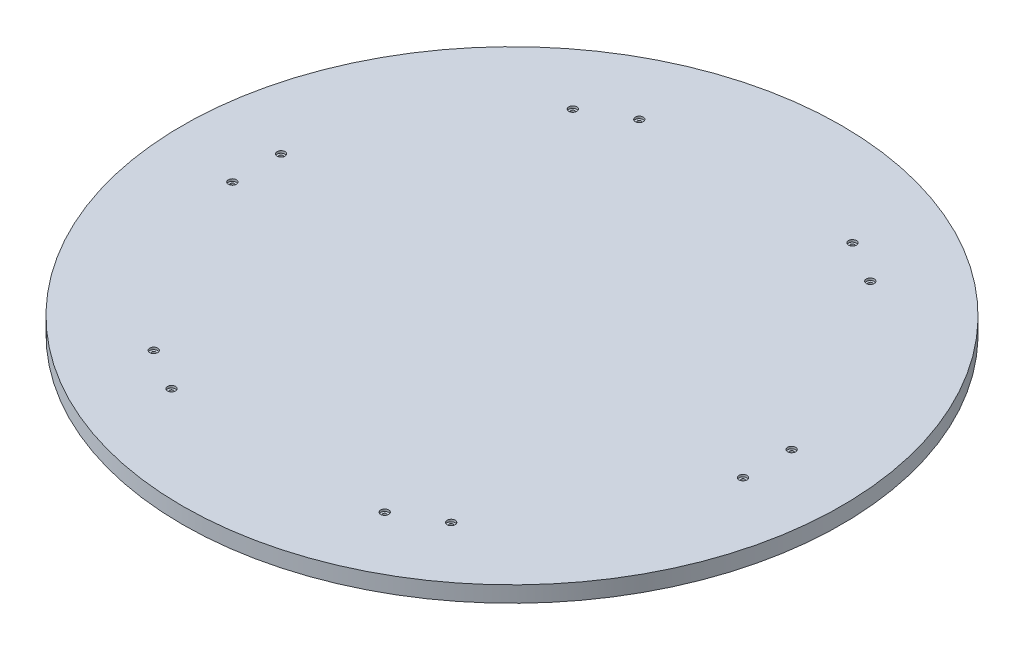
from build123d import *

# Parameters (mm, degrees)
SKETCH1_R           = 261.9375
BOSS_EXTRUDE1_DEPTH = 12.7
CUT_EXTRUDE4_DEPTH  = 6.35
SKETCH7_R           = 1.524
CUT_EXTRUDE5_DEPTH  = 371.489986791
SKETCH8_R           = 3.175
CUT_EXTRUDE6_DEPTH  = 1.778


with BuildPart() as part:
    # Sketch1 → Boss-Extrude1 (new body)
    with BuildSketch(Plane(origin=(0, 0, 0), x_dir=(1, 0, 0), z_dir=(0, 1, 0))):
        Circle(SKETCH1_R)
    extrude(amount=BOSS_EXTRUDE1_DEPTH)

    # Sketch6 → Cut-Extrude4 (cut)
    with BuildSketch(Plane.XZ):
        with BuildLine():
            Line((215.9, 19.05), (215.9, -19.05))
            ThreePointArc((215.9, -19.05), (203.2, -31.75), (190.5, -19.05))
            Line((190.5, -19.05), (190.5, 19.05))
            ThreePointArc((190.5, 19.05), (203.2, 31.75), (215.9, 19.05))
        make_face()
        with BuildLine():
            Line((124.447783942, -177.449884677), (91.452216058, -196.499884677))
            ThreePointArc((91.452216058, -196.499884677), (74.10369343, -191.851362049), (78.752216058, -174.502839421))
            Line((78.752216058, -174.502839421), (111.747783942, -155.452839421))
            ThreePointArc((111.747783942, -155.452839421), (129.09630657, -160.101362049), (124.447783942, -177.449884677))
        make_face()
        with BuildLine():
            Line((-91.452216058, -196.499884677), (-124.447783942, -177.449884677))
            ThreePointArc((-124.447783942, -177.449884677), (-129.09630657, -160.101362049), (-111.747783942, -155.452839421))
            Line((-111.747783942, -155.452839421), (-78.752216058, -174.502839421))
            ThreePointArc((-78.752216058, -174.502839421), (-74.10369343, -191.851362049), (-91.452216058, -196.499884677))
        make_face()
        with BuildLine():
            Line((-215.9, -19.05), (-215.9, 19.05))
            ThreePointArc((-215.9, 19.05), (-203.2, 31.75), (-190.5, 19.05))
            Line((-190.5, 19.05), (-190.5, -19.05))
            ThreePointArc((-190.5, -19.05), (-203.2, -31.75), (-215.9, -19.05))
        make_face()
        with BuildLine():
            Line((-124.447783942, 177.449884677), (-91.452216058, 196.499884677))
            ThreePointArc((-91.452216058, 196.499884677), (-74.10369343, 191.851362049), (-78.752216058, 174.502839421))
            Line((-78.752216058, 174.502839421), (-111.747783942, 155.452839421))
            ThreePointArc((-111.747783942, 155.452839421), (-129.09630657, 160.101362049), (-124.447783942, 177.449884677))
        make_face()
        with BuildLine():
            Line((91.452216058, 196.499884677), (124.447783942, 177.449884677))
            ThreePointArc((124.447783942, 177.449884677), (129.09630657, 160.101362049), (111.747783942, 155.452839421))
            Line((111.747783942, 155.452839421), (78.752216058, 174.502839421))
            ThreePointArc((78.752216058, 174.502839421), (74.10369343, 191.851362049), (91.452216058, 196.499884677))
        make_face()
    extrude(amount=-CUT_EXTRUDE4_DEPTH, mode=Mode.SUBTRACT)

    # Sketch7 → Cut-Extrude5 (cut, through all)
    with BuildSketch(Plane.XZ.offset(-6.35)):
        with Locations((203.2, -19.05)):
            Circle(SKETCH7_R)
        with Locations((203.2, 19.624496846)):
            Circle(SKETCH7_R)
        with Locations((85.102216058, -185.501362049)):
            Circle(SKETCH7_R)
        with Locations((118.595312805, -166.164113626)):
            Circle(SKETCH7_R)
        with Locations((-118.097783942, -166.451362049)):
            Circle(SKETCH7_R)
        with Locations((-84.604687195, -185.788610472)):
            Circle(SKETCH7_R)
        with Locations((-203.2, 19.05)):
            Circle(SKETCH7_R)
        with Locations((-203.2, -19.624496846)):
            Circle(SKETCH7_R)
        with Locations((-85.102216058, 185.501362049)):
            Circle(SKETCH7_R)
        with Locations((-118.595312805, 166.164113626)):
            Circle(SKETCH7_R)
        with Locations((118.097783942, 166.451362049)):
            Circle(SKETCH7_R)
        with Locations((84.604687195, 185.788610472)):
            Circle(SKETCH7_R)
    extrude(amount=-CUT_EXTRUDE5_DEPTH, mode=Mode.SUBTRACT)

    # Sketch8 → Cut-Extrude6 (cut)
    with BuildSketch(Plane(origin=(0, 12.7, 0), x_dir=(1, 0, 0), z_dir=(0, 1, 0))):
        with Locations((203.2, -19.624496846)):
            Circle(SKETCH8_R)
        with Locations((203.2, 19.05)):
            Circle(SKETCH8_R)
        with Locations((118.097783942, -166.451362049)):
            Circle(SKETCH8_R)
        with Locations((84.604687195, -185.788610472)):
            Circle(SKETCH8_R)
        with Locations((-85.102216058, -185.501362049)):
            Circle(SKETCH8_R)
        with Locations((-118.595312805, -166.164113626)):
            Circle(SKETCH8_R)
        with Locations((-203.2, -19.05)):
            Circle(SKETCH8_R)
        with Locations((-203.2, 19.624496846)):
            Circle(SKETCH8_R)
        with Locations((-118.097783942, 166.451362049)):
            Circle(SKETCH8_R)
        with Locations((-84.604687195, 185.788610472)):
            Circle(SKETCH8_R)
        with Locations((85.102216058, 185.501362049)):
            Circle(SKETCH8_R)
        with Locations((118.595312805, 166.164113626)):
            Circle(SKETCH8_R)
    extrude(amount=-CUT_EXTRUDE6_DEPTH, mode=Mode.SUBTRACT)


solid = part.part
